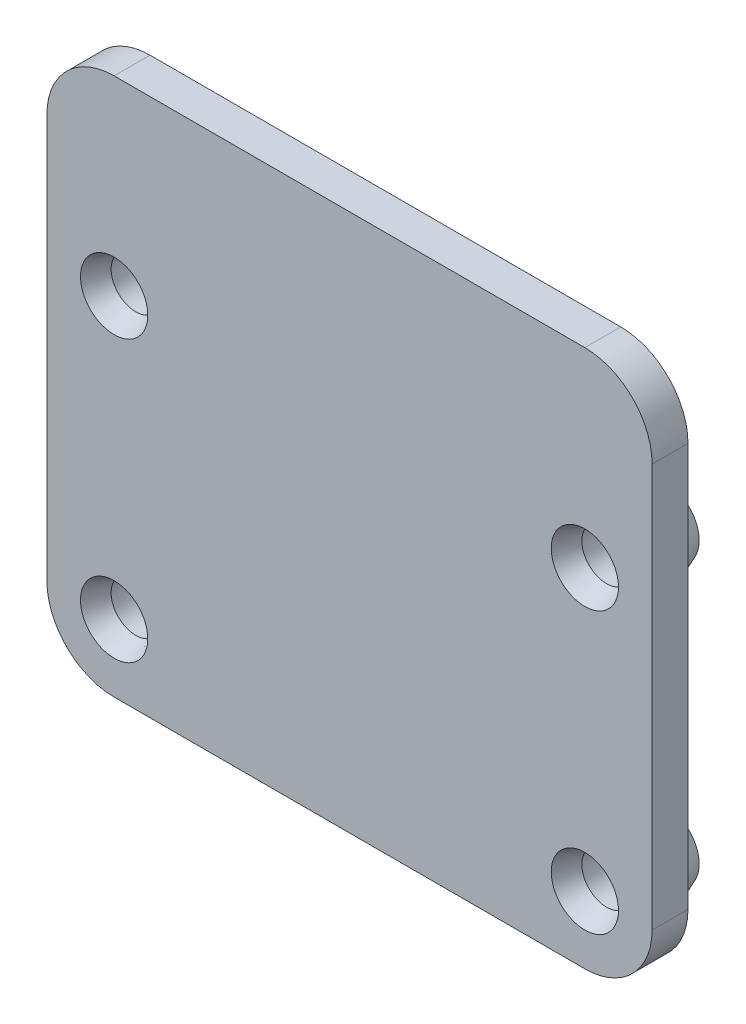
from build123d import *

# Parameters (mm, degrees)
BOSS_EXTRUDE1_DEPTH           = 1.6
SKETCH4_R                     = 2.3
BOSS_EXTRUDE2_DEPTH           = 2
M2_CLEARANCE_HOLE1_AT_2_COUNT = 2
M2_CLEARANCE_HOLE1_AT_2_PITCH = 12.5
M2_CLEARANCE_HOLE1_AT_3_COUNT = 2
M2_CLEARANCE_HOLE1_AT_3_PITCH = 24.43869882
M2_CLEARANCE_HOLE1_AT_4_COUNT = 2
M2_CLEARANCE_HOLE1_AT_4_PITCH = 21
CHAMFER1_SIZE                 = 2
CHAMFER1_SIZE_2               = 0.8


with BuildPart() as part:
    # Sketch1 → Boss-Extrude1 (new body)
    with BuildSketch(Plane.XY):
        with BuildLine():
            Line((10.50000068, 13.480003898), (-10.50000068, 13.480003898))
            ThreePointArc((-10.50000068, 13.480003898), (-12.621321024, 12.601324241), (-13.50000068, 10.480003898))
            Line((-13.50000068, 10.480003898), (-13.50000068, -7.519996102))
            ThreePointArc((-13.50000068, -7.519996102), (-12.621321024, -9.641316446), (-10.50000068, -10.519996102))
            Line((-10.50000068, -10.519996102), (10.50000068, -10.519996102))
            ThreePointArc((10.50000068, -10.519996102), (12.621321024, -9.641316446), (13.50000068, -7.519996102))
            Line((13.50000068, -7.519996102), (13.50000068, 10.480003898))
            ThreePointArc((13.50000068, 10.480003898), (12.621321024, 12.601324241), (10.50000068, 13.480003898))
        make_face()
    extrude(amount=BOSS_EXTRUDE1_DEPTH)

    # Sketch4 → Boss-Extrude2 (add)
    with BuildSketch(Plane(origin=(0, 0, 0), x_dir=(-1, 0, 0), z_dir=(0, 0, -1))):
        with Locations((-10.500001265, 4.980003898)):
            Circle(SKETCH4_R)
        with Locations((10.499998735, 4.98000488)):
            Circle(SKETCH4_R)
        with Locations((10.50000068, -7.519996102)):
            Circle(SKETCH4_R)
        with Locations((-10.50000068, -7.519996102)):
            Circle(SKETCH4_R)
    extrude(amount=BOSS_EXTRUDE2_DEPTH)

    # Sketch3 → M2 Clearance Hole1 (revolve, cut)
    with BuildSketch(Plane(origin=(10.500001265, 4.980003898, 1.6), x_dir=(0, -1, 0), z_dir=(1, 0, 0))):
        Polygon((0, 0), (0, 3.6), (1.1, 3.6), (1.1, 0.965685425), (1.5, 0), align=None)
    m2_clearance_hole1 = revolve(axis=Axis((10.500001265, 4.980003898, 7.95), (0, 0, -1)), mode=Mode.SUBTRACT)

    # M2 Clearance Hole1 at 2: M2 Clearance Hole1 ×2
    with Locations(*[(0, -i * M2_CLEARANCE_HOLE1_AT_2_PITCH, 0) for i in range(1, M2_CLEARANCE_HOLE1_AT_2_COUNT)]):
        add(m2_clearance_hole1, mode=Mode.SUBTRACT)

    # M2 Clearance Hole1 at 3: M2 Clearance Hole1 ×2
    with Locations(*[Vector(-0.8592929083374752, -0.5114838195690296, 0) * (i * M2_CLEARANCE_HOLE1_AT_3_PITCH) for i in range(1, M2_CLEARANCE_HOLE1_AT_3_COUNT)]):
        add(m2_clearance_hole1, mode=Mode.SUBTRACT)

    # M2 Clearance Hole1 at 4: M2 Clearance Hole1 ×2
    with Locations(*[(-i * M2_CLEARANCE_HOLE1_AT_4_PITCH, 0, 0) for i in range(1, M2_CLEARANCE_HOLE1_AT_4_COUNT)]):
        add(m2_clearance_hole1, mode=Mode.SUBTRACT)

    # Chamfer1
    # the kernel refuses this chamfer: 2, 0.8 mm, written as the material it takes off along each edge
    with BuildSketch(Plane(origin=(10.500001265, 4.980003898, -2), x_dir=(-1, 0, 0), z_dir=(0, -1, 0))) as chamfer1_piece_1_section:
        Polygon((2.3, -CHAMFER1_SIZE), (2.3 - CHAMFER1_SIZE_2, 0), (2.3, 0), align=None)
    chamfer1_piece_1 = revolve(axis=Axis((10.500001265, 4.980003898, -2), (0, 0, -1)), mode=Mode.PRIVATE)
    chamfer1_piece_1 = split(chamfer1_piece_1, bisect_by=Plane(origin=(12.406400558, 4.980003898, 0), z_dir=(0, 0, -1)), keep=Keep.TOP, mode=Mode.PRIVATE)
    add(chamfer1_piece_1, mode=Mode.SUBTRACT)
    with BuildSketch(Plane(origin=(-10.499998735, 4.98000488, -2), x_dir=(-1, 0, 0), z_dir=(0, -1, 0))) as chamfer1_piece_2_section:
        Polygon((2.3, -CHAMFER1_SIZE), (2.3 - CHAMFER1_SIZE_2, 0), (2.3, 0), align=None)
    chamfer1_piece_2 = revolve(axis=Axis((-10.499998735, 4.98000488, -2), (0, 0, -1)), mode=Mode.PRIVATE)
    chamfer1_piece_2 = split(chamfer1_piece_2, bisect_by=Plane(origin=(-8.593599442, 4.98000488, 0), z_dir=(0, 0, -1)), keep=Keep.TOP, mode=Mode.PRIVATE)
    add(chamfer1_piece_2, mode=Mode.SUBTRACT)
    with BuildSketch(Plane(origin=(-10.50000068, -7.519996102, -2), x_dir=(-1, 0, 0), z_dir=(0, -1, 0))) as chamfer1_piece_3_section:
        Polygon((2.3, -CHAMFER1_SIZE), (2.3 - CHAMFER1_SIZE_2, 0), (2.3, 0), align=None)
    chamfer1_piece_3 = revolve(axis=Axis((-10.50000068, -7.519996102, -2), (0, 0, -1)), mode=Mode.PRIVATE)
    chamfer1_piece_3 = split(chamfer1_piece_3, bisect_by=Plane(origin=(-8.593601387, -7.519996102, 0), z_dir=(0, 0, -1)), keep=Keep.TOP, mode=Mode.PRIVATE)
    add(chamfer1_piece_3, mode=Mode.SUBTRACT)
    with BuildSketch(Plane(origin=(10.50000068, -7.519996102, -2), x_dir=(-1, 0, 0), z_dir=(0, -1, 0))) as chamfer1_piece_4_section:
        Polygon((2.3, -CHAMFER1_SIZE), (2.3 - CHAMFER1_SIZE_2, 0), (2.3, 0), align=None)
    chamfer1_piece_4 = revolve(axis=Axis((10.50000068, -7.519996102, -2), (0, 0, -1)), mode=Mode.PRIVATE)
    chamfer1_piece_4 = split(chamfer1_piece_4, bisect_by=Plane(origin=(12.406399973, -7.519996102, 0), z_dir=(0, 0, -1)), keep=Keep.TOP, mode=Mode.PRIVATE)
    add(chamfer1_piece_4, mode=Mode.SUBTRACT)


solid = part.part
